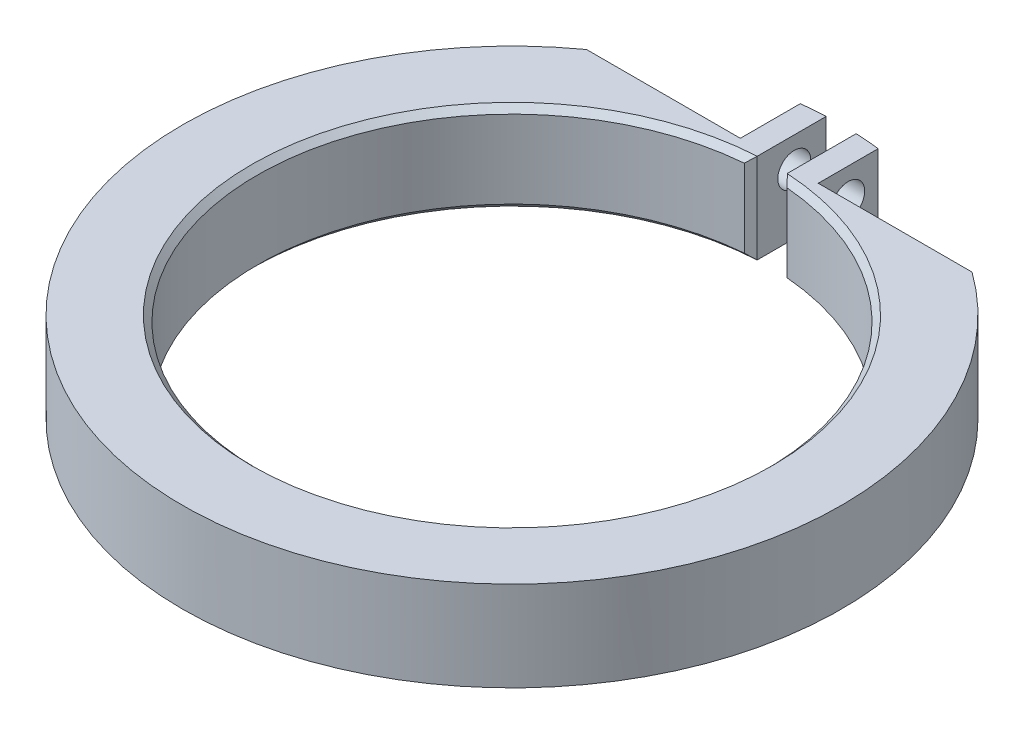
from build123d import *

# Parameters (mm, degrees)
SKETCH1_R           = 55
SKETCH1_R_2         = 42.5
BOSS_EXTRUDE1_DEPTH = 15
CUT_EXTRUDE1_DEPTH  = 80.214897589
CUT_EXTRUDE2_START  = -10
CUT_EXTRUDE2_DEPTH  = 10
SKETCH4_R           = 2.75
CUT_EXTRUDE3_DEPTH  = 84.858511792
FILLET2_R           = 2
CHAMFER1_SIZE       = 1.064458421
CHAMFER1_SIZE_2     = 1


with BuildPart() as part:
    # Sketch1 → Boss-Extrude1 (new body)
    with BuildSketch(Plane(origin=(0, 0, 0), x_dir=(1, 0, 0), z_dir=(0, 1, 0))):
        with Locations(Location((0, 0, 0), (0, 0, 270))):
            Circle(SKETCH1_R)
        with Locations(Location((0, 0, 0), (0, 0, 270))):
            Circle(SKETCH1_R_2, mode=Mode.SUBTRACT)
    extrude(amount=BOSS_EXTRUDE1_DEPTH)

    # Sketch2 → Cut-Extrude1 (cut, through all)
    with BuildSketch(Plane(origin=(0, 15, 0), x_dir=(1, 0, 0), z_dir=(0, 1, 0))):
        with BuildLine():
            Line((-2.5, 42.426406871), (-2.5, 54.94315244))
            ThreePointArc((-2.5, 54.94315244), (0, 55), (2.5, 54.94315244))
            Line((2.5, 54.94315244), (2.5, 42.426406871))
            ThreePointArc((2.5, 42.426406871), (0, 42.5), (-2.5, 42.426406871))
        make_face()
    extrude(amount=-CUT_EXTRUDE1_DEPTH, mode=Mode.SUBTRACT)

    # Sketch3 → Cut-Extrude2 (cut)
    with BuildSketch(Plane(origin=(0, 15, 0), x_dir=(1, 0, 0), z_dir=(0, 1, 0)).offset(CUT_EXTRUDE2_START)):
        with BuildLine():
            Line((-6.5, 54.614558499), (-6.5, 44.614558499))
            Line((-6.5, 44.614558499), (-32.164284074, 44.614558499))
            ThreePointArc((-32.164284074, 44.614558499), (-19.96826772, 51.247129522), (-6.5, 54.614558499))
        make_face()
        with BuildLine():
            Line((6.5, 44.614558499), (32.164284074, 44.614558499))
            ThreePointArc((32.164284074, 44.614558499), (19.96826772, 51.247129522), (6.5, 54.614558499))
            Line((6.5, 54.614558499), (6.5, 44.614558499))
        make_face()
    extrude(amount=CUT_EXTRUDE2_DEPTH, mode=Mode.SUBTRACT)

    # Sketch4 → Cut-Extrude3 (cut, through all)
    with BuildSketch(Plane.ZY.offset(6.5)):
        with Locations((-49.614558499, 10)):
            Circle(SKETCH4_R)
    extrude(amount=-CUT_EXTRUDE3_DEPTH, mode=Mode.SUBTRACT)

    # Fillet2
    fillet2_edges = [part.edges().sort_by_distance(p)[0] for p in [
        (-19.332142037, 5, -44.614558499),
        (19.332142037, 5, -44.614558499),
    ]]
    fillet(fillet2_edges, radius=FILLET2_R)

    # Chamfer1
    # the kernel refuses this chamfer: 1.064458421, 1 mm, written as the material it takes off along each edge
    with BuildSketch(Plane(origin=(2.5, 17.741623876, -42.426406871), x_dir=(0, 0, -1), z_dir=(0, -1, 0))) as chamfer1_piece_1:
        with BuildLine():
            Line((CHAMFER1_SIZE, 0), (-0.071563276, 1.009590298))
            ThreePointArc((-0.071563276, 1.009590298), (-0.033856315, 0.520208167), (0, 0))
            Line((0, 0), (CHAMFER1_SIZE, 0))
        make_face()
    extrude(amount=20.483247753, mode=Mode.SUBTRACT)
    with BuildSketch(Plane(origin=(-2.5, 17.781296166, -42.426406871), x_dir=(0, 0, -1), z_dir=(0, -1, 0))) as chamfer1_piece_2:
        with BuildLine():
            Line((CHAMFER1_SIZE_2, 0), (-0.077221697, -1.077221697))
            ThreePointArc((-0.077221697, -1.077221697), (-0.03634309, -0.554912866), (0, 0))
            Line((0, 0), (CHAMFER1_SIZE_2, 0))
        make_face()
    extrude(amount=20.562592333, mode=Mode.SUBTRACT)
    # the kernel refuses this chamfer: 1.064458421, 1 mm, written as the material it takes off along each edge
    with BuildSketch(Plane(origin=(0, 0, 0), x_dir=(-0.023665071979994685, 0, -0.9997199429681204), z_dir=(0.9997199429681204, 0, -0.023665071979994685))) as chamfer1_2_piece_1:
        Polygon((42.5 + CHAMFER1_SIZE_2, 0), (42.5, CHAMFER1_SIZE_2), (42.5, 0), align=None)
    revolve(axis=Axis((0, 0, 0), (0, 1, 0)), revolution_arc=178.643964662, mode=Mode.SUBTRACT)
    with BuildSketch(Plane(origin=(0, 15, 0), x_dir=(0, 0, 1), z_dir=(-1, 0, 0))) as chamfer1_2_piece_2:
        Polygon((42.5 + CHAMFER1_SIZE_2, 0), (42.5, -CHAMFER1_SIZE_2), (42.5, 0), align=None)
    revolve(axis=Axis((0, 15, 0), (0, 1, 0)), revolution_arc=178.735465076, mode=Mode.SUBTRACT)
    with BuildSketch(Plane(origin=(0, 15, 0), x_dir=(-0.023665071979993797, 0, -0.9997199429681204), z_dir=(0.9997199429681204, 0, -0.023665071979993797))) as chamfer1_2_piece_3:
        Polygon((42.5 + CHAMFER1_SIZE_2, 0), (42.5, -CHAMFER1_SIZE_2), (42.5, 0), align=None)
    revolve(axis=Axis((0, 15, 0), (0, 1, 0)), revolution_arc=178.643964662, mode=Mode.SUBTRACT)
    with BuildSketch(Plane(origin=(0, 0, 0), x_dir=(0, 0, 1), z_dir=(-1, 0, 0))) as chamfer1_2_piece_4:
        Polygon((42.5 + CHAMFER1_SIZE_2, 0), (42.5, CHAMFER1_SIZE_2), (42.5, 0), align=None)
    revolve(axis=Axis((0, 0, 0), (0, 1, 0)), revolution_arc=178.735465076, mode=Mode.SUBTRACT)


solid = part.part
